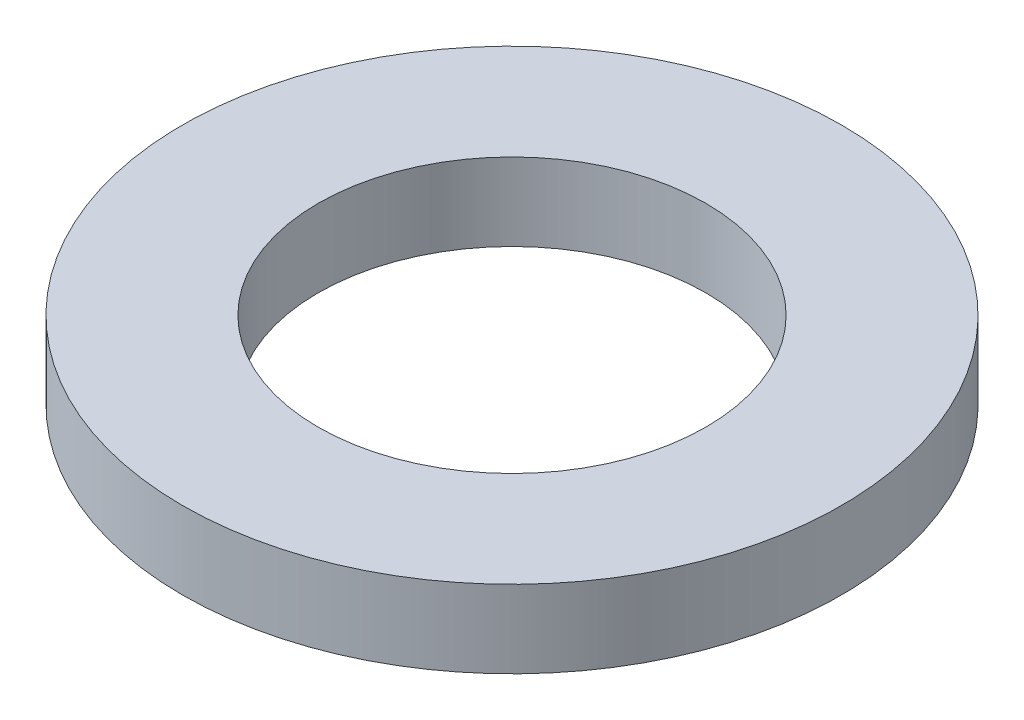
from build123d import *

# Parameters (mm, degrees)
SKETCH1_R           = 85
BOSS_EXTRUDE1_DEPTH = 20
SKETCH2_R           = 50
CUT_EXTRUDE1_DEPTH  = 122.86057607


with BuildPart() as part:
    # Sketch1 → Boss-Extrude1 (new body)
    with BuildSketch(Plane(origin=(0, 0, 0), x_dir=(1, 0, 0), z_dir=(0, 1, 0))):
        Circle(SKETCH1_R)
    extrude(amount=BOSS_EXTRUDE1_DEPTH)

    # Sketch2 → Cut-Extrude1 (cut, through all)
    with BuildSketch(Plane(origin=(0, 0, 0), x_dir=(1, 0, 0), z_dir=(0, 1, 0))):
        Circle(SKETCH2_R)
    extrude(amount=CUT_EXTRUDE1_DEPTH, mode=Mode.SUBTRACT)


solid = part.part
